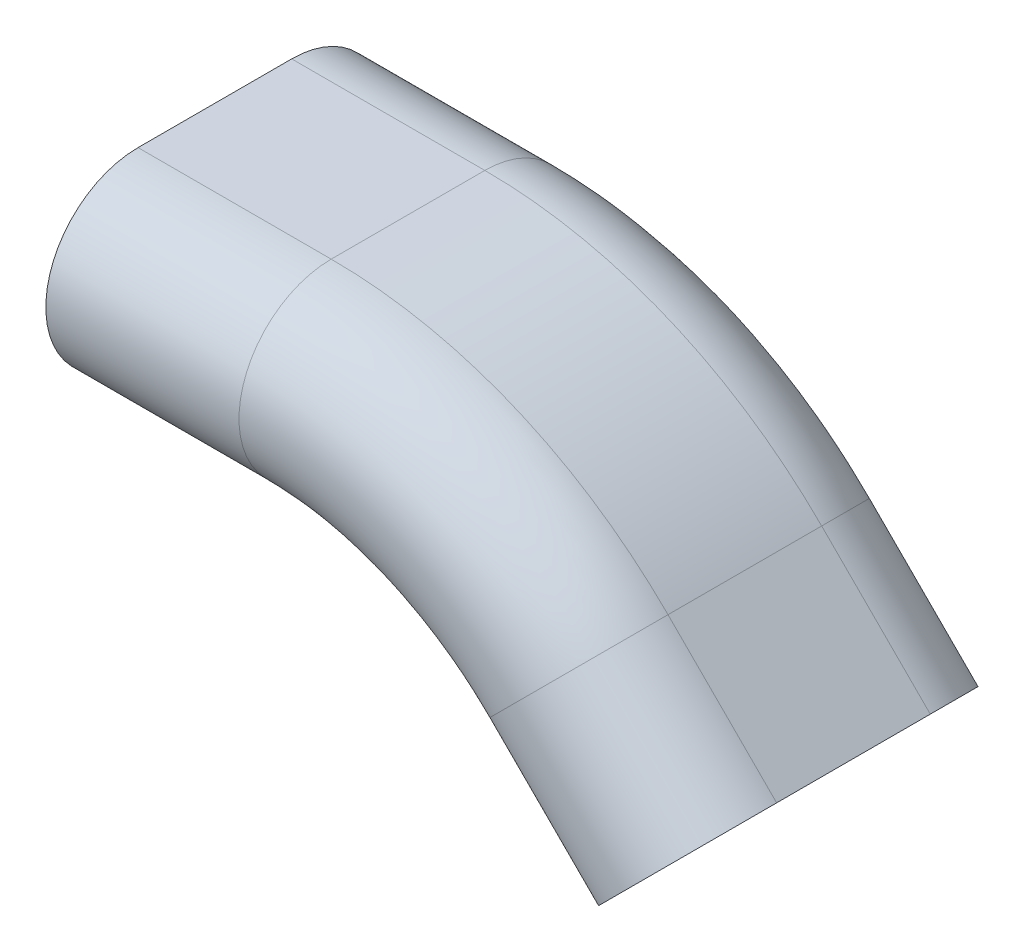
from build123d import *

# Parameters (mm, degrees)
FILLET1_R                       = 0.5
BOSS_EXTRUDE6_REACH             = 48.859
BOSS_EXTRUDE6_DIRECTION_2_REACH = 48.859


with BuildPart() as part:
    # Sweep1: sweep along a path in Sketch2path
    with BuildLine(Plane.XY) as sweep1_path:
        Line((37.320638873, -14.393398282), (30.249571061, -7.32233047))
        ThreePointArc((30.249571061, -7.32233047), (22.138987341, -1.903011687), (12.571901531, 0))
        Line((12.571901531, 0), (0, 0))
    # Sketch3 → Sweep1 (sweep)
    with BuildSketch(Plane(origin=(0, 0, 0), x_dir=(0, 0, -1), z_dir=(1, 0, 0))):
        with BuildLine():
            Line((-5, 6), (5, 6))
            ThreePointArc((5, 6), (11, 0), (5, -6))
            Line((5, -6), (-5, -6))
            ThreePointArc((-5, -6), (-11, 0), (-5, 6))
        make_face()
        with BuildLine():
            Line((-5, 5), (5, 5))
            ThreePointArc((5, 5), (10, 0), (5, -5))
            Line((5, -5), (-5, -5))
            ThreePointArc((-5, -5), (-10, 0), (-5, 5))
        make_face(mode=Mode.SUBTRACT)
    sweep(path=sweep1_path.line)

    # Fillet1
    fillet1_edges = [part.edges().sort_by_distance(p)[0] for p in [
        (0, 0, 10),
        (0, 5, 0),
        (0, 0, -10),
        (0, -5, 0),
    ]]
    fillet(fillet1_edges, radius=FILLET1_R)

    # Sketch13 → Boss-Extrude6 (add, up to next)
    with BuildSketch(Plane(origin=(0, 0, 0), x_dir=(1, 0, 0), z_dir=(0, 1, 0)), mode=Mode.PRIVATE) as boss_extrude6_sk1:
        with BuildLine():
            Line((15.99, -6), (16.01, -6))
            ThreePointArc((16.01, -6), (17.417142495, -6.582857505), (18, -7.99))
            Line((18, -7.99), (18, -10))
            Line((18, -10), (14, -10))
            Line((14, -10), (14, -7.99))
            ThreePointArc((14, -7.99), (14.582857505, -6.582857505), (15.99, -6))
        make_face()
    boss_extrude6_tool1 = extrude(boss_extrude6_sk1.sketch, amount=BOSS_EXTRUDE6_REACH, mode=Mode.PRIVATE) - part.part
    add(boss_extrude6_tool1.solids().sort_by_distance((16, 0, 8.184882))[0])

    # Sketch13 → Boss-Extrude6 direction 2 (add, up to next)
    with BuildSketch(Plane(origin=(0, 0, 0), x_dir=(1, 0, 0), z_dir=(0, 1, 0)), mode=Mode.PRIVATE) as boss_extrude6_direction_2_sk1:
        with BuildLine():
            Line((15.99, -6), (16.01, -6))
            ThreePointArc((16.01, -6), (17.417142495, -6.582857505), (18, -7.99))
            Line((18, -7.99), (18, -10))
            Line((18, -10), (14, -10))
            Line((14, -10), (14, -7.99))
            ThreePointArc((14, -7.99), (14.582857505, -6.582857505), (15.99, -6))
        make_face()
    boss_extrude6_direction_2_tool1 = extrude(boss_extrude6_direction_2_sk1.sketch, amount=-BOSS_EXTRUDE6_DIRECTION_2_REACH, mode=Mode.PRIVATE) - part.part
    add(boss_extrude6_direction_2_tool1.solids().sort_by_distance((16, 0, 8.184882))[0])


solid = part.part
